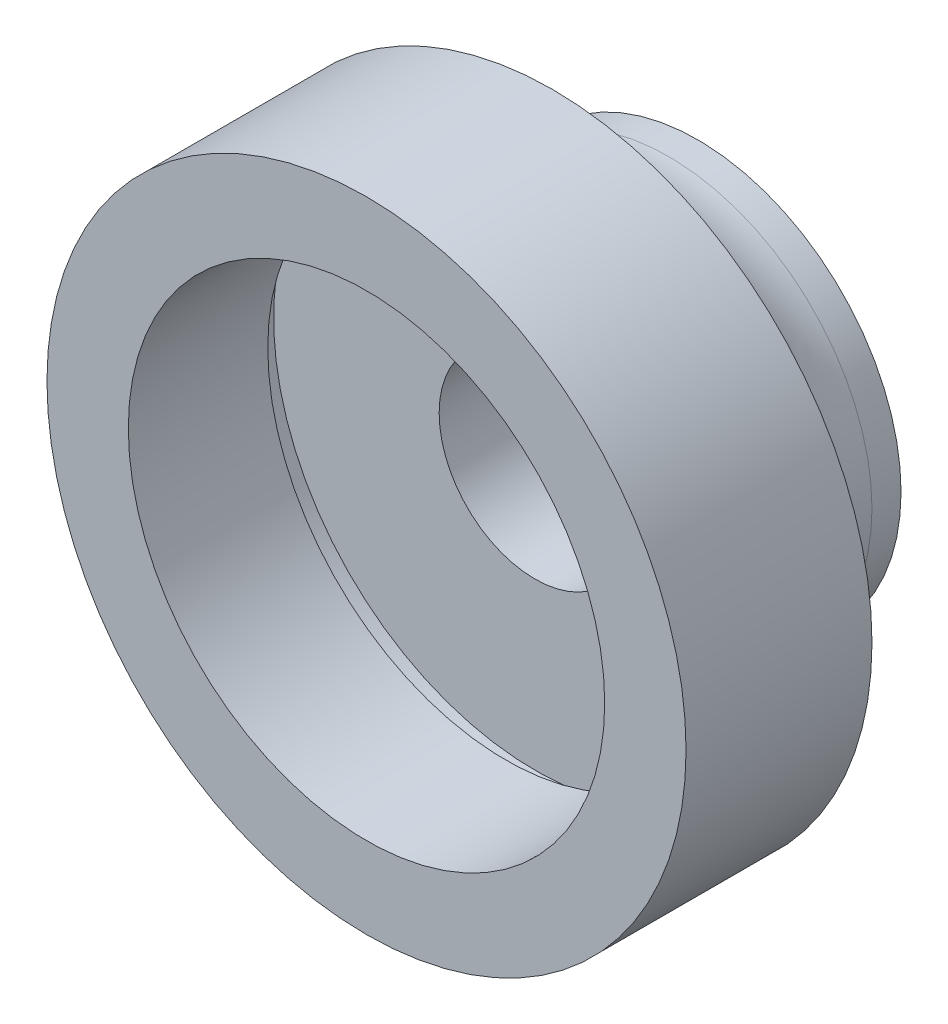
from build123d import *

# Parameters (mm, degrees)
BOSS_EXTRUDE1_DEPTH      = 1
BOSS_EXTRUDE1_DEPTH_BACK = 1.5
SKETCH1_R                = 3.5
SKETCH1_R_2              = 1.625
SKETCH2_R                = 5.5
BOSS_EXTRUDE2_DEPTH      = 3.2
SKETCH3_R                = 4.1
CUT_EXTRUDE1_DEPTH       = 2.9
SKETCH4_R                = 1.65
CUT_EXTRUDE2_DEPTH       = 10
FILLET2_R                = 2
SKETCH5_R                = 4.5
CUT_EXTRUDE3_DEPTH       = 0.5


with BuildPart() as part:
    # Sketch1 → Boss-Extrude1 (new, two sides: drawn at the far end of the back side and taken through both)
    with BuildSketch(Plane.XY.offset(-BOSS_EXTRUDE1_DEPTH_BACK)):
        Circle(SKETCH1_R)
        Circle(SKETCH1_R_2, mode=Mode.SUBTRACT)
    extrude(amount=BOSS_EXTRUDE1_DEPTH + BOSS_EXTRUDE1_DEPTH_BACK)

    # Sketch2 → Boss-Extrude2 (add)
    with BuildSketch(Plane.XY.offset(1)):
        Circle(SKETCH2_R)
    extrude(amount=BOSS_EXTRUDE2_DEPTH)

    # Sketch3 → Cut-Extrude1 (cut)
    with BuildSketch(Plane.XY.offset(4.2)):
        Circle(SKETCH3_R)
    extrude(amount=-CUT_EXTRUDE1_DEPTH, mode=Mode.SUBTRACT)

    # Sketch4 → Cut-Extrude2 (cut)
    with BuildSketch(Plane(origin=(0, 0, -1.5), x_dir=(-1, 0, 0), z_dir=(0, 0, -1))):
        Circle(SKETCH4_R)
    extrude(amount=-CUT_EXTRUDE2_DEPTH, mode=Mode.SUBTRACT)

    # Fillet2
    # the kernel refuses this fillet: 2 mm, written as the material it adds along each edge
    with BuildSketch(Plane(origin=(0, 0, 1), x_dir=(1, 0, 0), z_dir=(0, -1, 0))) as fillet2_piece_1:
        with BuildLine():
            CenterArc((3.5 + FILLET2_R, -FILLET2_R), FILLET2_R, 90, 90)
            Line((3.5, -FILLET2_R), (3.5, 0))
            Line((3.5, 0), (3.5 + FILLET2_R, 0))
        make_face()
    revolve(axis=Axis((0, 0, 1), (0, 0, 1)))

    # Sketch5 → Cut-Extrude3 (cut)
    with BuildSketch(Plane.XY.offset(1.3)):
        Circle(SKETCH5_R)
    extrude(amount=CUT_EXTRUDE3_DEPTH, mode=Mode.SUBTRACT)


solid = part.part
